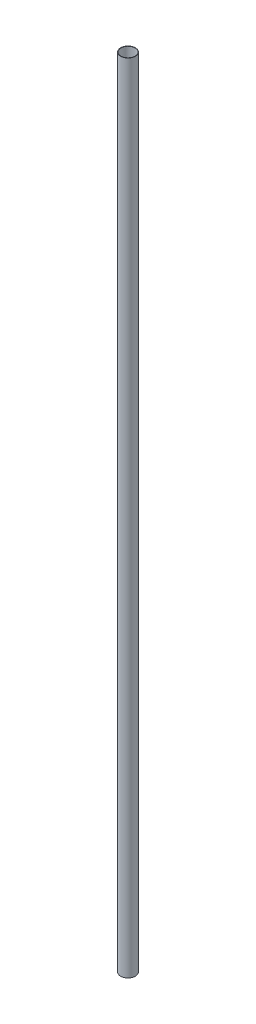
from build123d import *

# Parameters (mm, degrees)
SKETCH1_R           = 12.5
SKETCH1_R_2         = 12
BOSS_EXTRUDE1_DEPTH = 1350


with BuildPart() as part:
    # Sketch1 → Boss-Extrude1 (new body)
    with BuildSketch(Plane(origin=(0, 0, 0), x_dir=(1, 0, 0), z_dir=(0, 1, 0))):
        with Locations((-79.120282832, 11.893080489)):
            Circle(SKETCH1_R)
        with Locations((-79.120282832, 11.893080489)):
            Circle(SKETCH1_R_2, mode=Mode.SUBTRACT)
    extrude(amount=BOSS_EXTRUDE1_DEPTH)


solid = part.part
